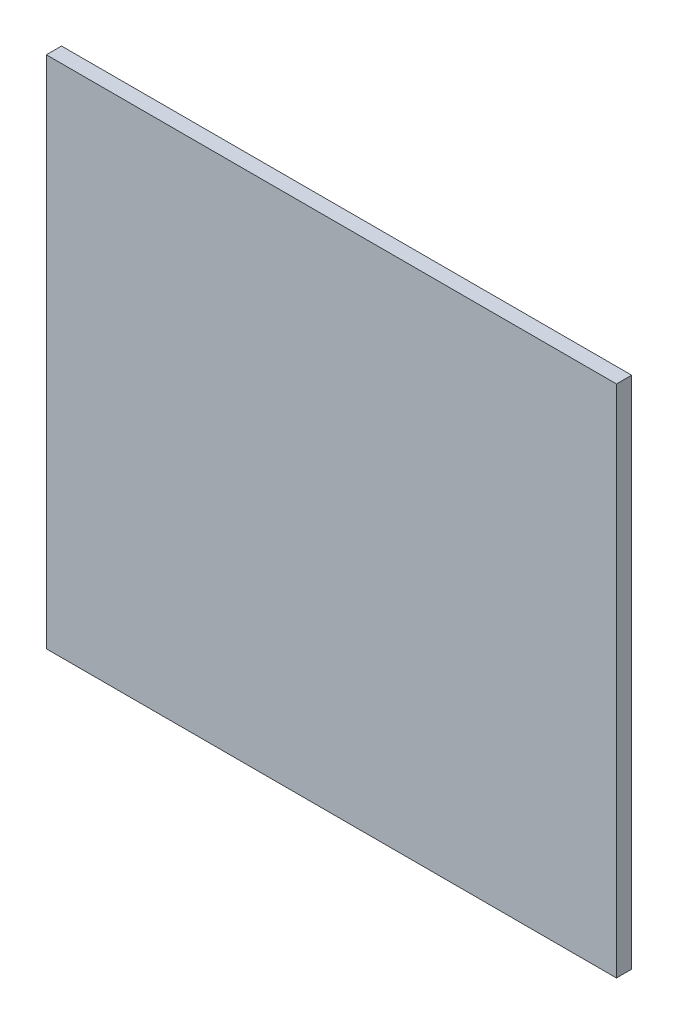
from build123d import *

# Parameters (mm, degrees)
SKETCH1_W           = 338
SKETCH1_H           = 305
BOSS_EXTRUDE1_DEPTH = 9


with BuildPart() as part:
    # Sketch1 → Boss-Extrude1 (new body)
    with BuildSketch(Plane.XY):
        Rectangle(SKETCH1_W, SKETCH1_H)
    extrude(amount=BOSS_EXTRUDE1_DEPTH)


solid = part.part
